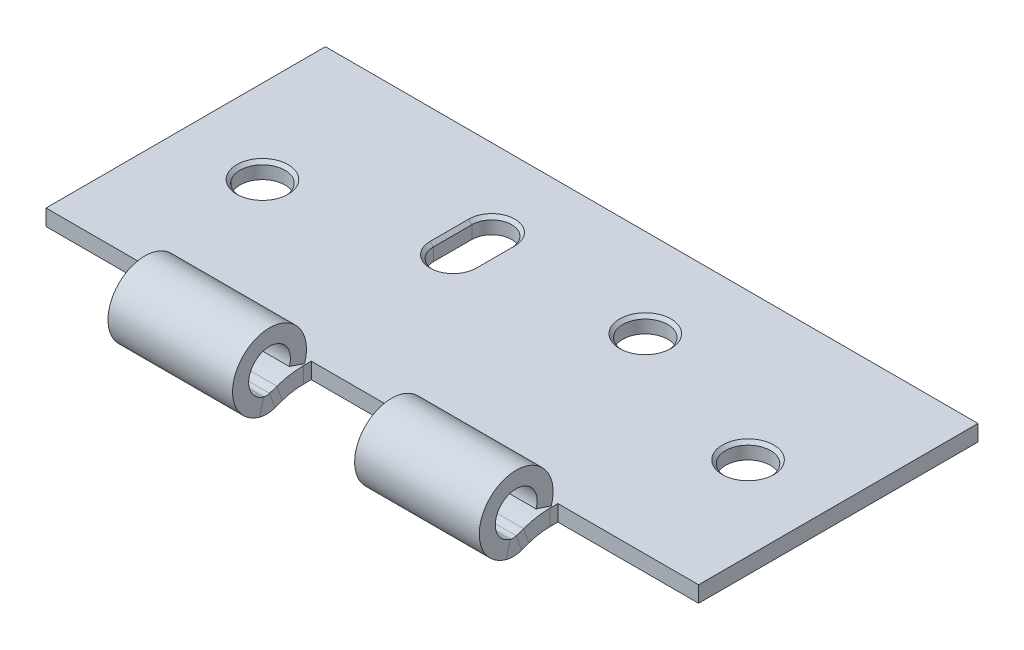
from build123d import *

# Parameters (mm, degrees)
BASE_FLANGE1_DEPTH           = 50.8
CUT_EXTRUDE1_DEPTH           = 72.510156621
CUT_EXTRUDE1_DEPTH_BACK      = 72.510156621
SKETCH6_W                    = 21.9
SKETCH6_H                    = 58.896012785
SKETCH6_W_2                  = 19
F_7_0_7_DIAMETER_HOLE1_D     = 7
F_7_0_7_DIAMETER_HOLE1_DEPTH = 10
F_7_0_7_DIAMETER_HOLE1_TIP   = 2.103012167
CUT_EXTRUDE2_DEPTH           = 10
CHAMFER1_SIZE                = 0.5


# Sheet-metal steps are written as plain solids
with BuildPart() as part:
    # Sketch1 → Base-Flange1 (new, symmetric)
    with BuildSketch(Plane(origin=(0, 0, 0), x_dir=(0, 0, -1), z_dir=(1, 0, 0))):
        with BuildLine():
            Line((50, -4.5), (5.275314915, -4.5))
            ThreePointArc((5.275314915, -4.5), (3.603327521, -4.640767872), (1.978412548, -5.059108369))
            Line((1.978412548, -5.059108369), (0.835379329, -5.458272884))
            ThreePointArc((0.835379329, -5.458272884), (-0.371159142, -5.680341687), (-1.588253888, -5.526296191))
            ThreePointArc((-1.588253888, -5.526296191), (-2.687165368, 5.083467546), (5.460998077, -1.8))
            Line((5.460998077, -1.8), (3.086651087, -1.017391304))
            ThreePointArc((3.086651087, -1.017391304), (-1.518832599, 2.873264265), (-0.897708719, -3.123558716))
            ThreePointArc((-0.897708719, -3.123558716), (-0.44129819, -3.181325777), (0.011153737, -3.098049977))
            Line((0.011153737, -3.098049977), (1.154186957, -2.698885462))
            ThreePointArc((1.154186957, -2.698885462), (3.185330673, -2.17595984), (5.275314915, -2))
            Line((5.275314915, -2), (50, -2))
            Line((50, -2), (50, -4.5))
        make_face()
    extrude(amount=BASE_FLANGE1_DEPTH, both=True)

    # Sketch6 → Cut-Extrude1 (cut, two sides: drawn at the far end of the back side and taken through both)
    with BuildSketch(Plane(origin=(0, 0, 0), x_dir=(1, 0, 0), z_dir=(0, 1, 0)).offset(-CUT_EXTRUDE1_DEPTH_BACK)):
        with Locations((-39.85, -22.948006393)):
            Rectangle(SKETCH6_W, SKETCH6_H)
        with Locations((39.85, -22.948006393)):
            Rectangle(SKETCH6_W, SKETCH6_H)
        with Locations((0, -22.948006393)):
            Rectangle(SKETCH6_W_2, SKETCH6_H)
    extrude(amount=CUT_EXTRUDE1_DEPTH + CUT_EXTRUDE1_DEPTH_BACK, mode=Mode.SUBTRACT)

    # Ø7.0 (7) Diameter Hole1
    with Locations(Plane(origin=(0, -2, 0), x_dir=(1, 0, 0), z_dir=(0, 1, 0))):
        with Locations((37.8, 27.2), (-37.8, 27.2), (12.8, 36.2)):
            Hole(F_7_0_7_DIAMETER_HOLE1_D / 2, depth=F_7_0_7_DIAMETER_HOLE1_DEPTH)
            with Locations((0, 0, -(F_7_0_7_DIAMETER_HOLE1_DEPTH + F_7_0_7_DIAMETER_HOLE1_TIP / 2))):  # 118° drill point
                Cone(0, F_7_0_7_DIAMETER_HOLE1_D / 2, F_7_0_7_DIAMETER_HOLE1_TIP, mode=Mode.SUBTRACT)

    # Sketch9 → Cut-Extrude2 (cut)
    with BuildSketch(Plane(origin=(0, -2, 0), x_dir=(1, 0, 0), z_dir=(0, 1, 0))):
        with BuildLine():
            Line((-9.7, 37.9), (-9.7, 31.9))
            ThreePointArc((-9.7, 31.9), (-12.8, 28.8), (-15.9, 31.9))
            Line((-15.9, 31.9), (-15.9, 37.9))
            ThreePointArc((-15.9, 37.9), (-12.8, 41), (-9.7, 37.9))
        make_face()
    extrude(amount=-CUT_EXTRUDE2_DEPTH, mode=Mode.SUBTRACT)

    # Chamfer1
    chamfer1_edges = [part.edges().sort_by_distance(p)[0] for p in [
        (16.3, -2, -36.2),
        (-34.3, -2, -27.2),
        (41.3, -2, -27.2),
        (-12.8, -2, -41),
        (-15.9, -2, -34.9),
        (-12.8, -2, -28.8),
        (-9.7, -2, -34.9),
    ]]
    chamfer(chamfer1_edges, length=CHAMFER1_SIZE)


solid = part.part
